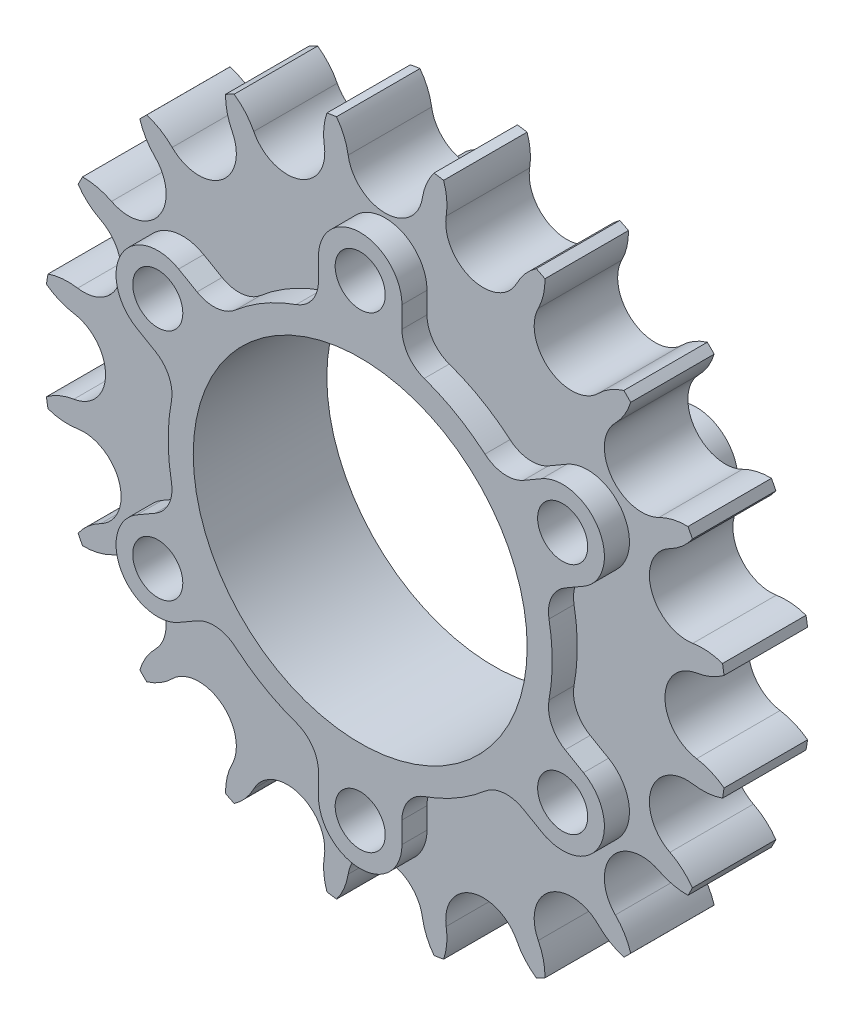
from build123d import *

# Parameters (mm, degrees)
SKETCH1_R           = 20.5
SKETCH1_R_2         = 10
BOSS_EXTRUDE1_DEPTH = 2.5
SKETCH2_R           = 10
BOSS_EXTRUDE2_DEPTH = 4
SKETCH3_R           = 1.5
CUT_EXTRUDE1_DEPTH  = 10
CUT_EXTRUDE2_DEPTH  = 30.266021253
CIRPATTERN1_COUNT   = 20


with BuildPart() as part:
    # Sketch1 → Boss-Extrude1 (new, symmetric)
    with BuildSketch(Plane.XY):
        Circle(SKETCH1_R)
        Circle(SKETCH1_R_2, mode=Mode.SUBTRACT)
    extrude(amount=BOSS_EXTRUDE1_DEPTH, both=True)

    # Sketch2 → Boss-Extrude2 (add, symmetric)
    with BuildSketch(Plane.XY):
        with BuildLine():
            Line((2.5, 14), (2.5, 12.727922061))
            ThreePointArc((2.5, 12.727922061), (2.867006838, 11.573221523), (3.833333333, 10.842303978))
            ThreePointArc((3.833333333, 10.842303978), (5.75, 9.959292144), (7.473044014, 8.740916037))
            ThreePointArc((7.473044014, 8.740916037), (8.589200423, 8.269511516), (9.772703843, 8.52902454))
            Line((9.772703843, 8.52902454), (10.874355653, 9.165063509))
            ThreePointArc((10.874355653, 9.165063509), (14.289419162, 8.25), (13.374355653, 4.834936491))
            Line((13.374355653, 4.834936491), (12.272703843, 4.198897521))
            ThreePointArc((12.272703843, 4.198897521), (11.456207262, 3.303710007), (11.306377347, 2.101387941))
            ThreePointArc((11.306377347, 2.101387941), (11.5, 0), (11.306377347, -2.101387941))
            ThreePointArc((11.306377347, -2.101387941), (11.456207262, -3.303710007), (12.272703843, -4.198897521))
            Line((12.272703843, -4.198897521), (13.374355653, -4.834936491))
            ThreePointArc((13.374355653, -4.834936491), (14.289419162, -8.25), (10.874355653, -9.165063509))
            Line((10.874355653, -9.165063509), (9.772703843, -8.52902454))
            ThreePointArc((9.772703843, -8.52902454), (8.589200423, -8.269511516), (7.473044014, -8.740916037))
            ThreePointArc((7.473044014, -8.740916037), (5.75, -9.959292144), (3.833333333, -10.842303978))
            ThreePointArc((3.833333333, -10.842303978), (2.867006838, -11.573221523), (2.5, -12.727922061))
            Line((2.5, -12.727922061), (2.5, -14))
            ThreePointArc((2.5, -14), (0, -16.5), (-2.5, -14))
            Line((-2.5, -14), (-2.5, -12.727922061))
            ThreePointArc((-2.5, -12.727922061), (-2.867006838, -11.573221523), (-3.833333333, -10.842303978))
            ThreePointArc((-3.833333333, -10.842303978), (-5.75, -9.959292144), (-7.473044014, -8.740916037))
            ThreePointArc((-7.473044014, -8.740916037), (-8.589200423, -8.269511516), (-9.772703843, -8.52902454))
            Line((-9.772703843, -8.52902454), (-10.874355653, -9.165063509))
            ThreePointArc((-10.874355653, -9.165063509), (-14.289419162, -8.25), (-13.374355653, -4.834936491))
            Line((-13.374355653, -4.834936491), (-12.272703843, -4.198897521))
            ThreePointArc((-12.272703843, -4.198897521), (-11.456207262, -3.303710007), (-11.306377347, -2.101387941))
            ThreePointArc((-11.306377347, -2.101387941), (-11.5, 0), (-11.306377347, 2.101387941))
            ThreePointArc((-11.306377347, 2.101387941), (-11.456207262, 3.303710007), (-12.272703843, 4.198897521))
            Line((-12.272703843, 4.198897521), (-13.374355653, 4.834936491))
            ThreePointArc((-13.374355653, 4.834936491), (-14.289419162, 8.25), (-10.874355653, 9.165063509))
            Line((-10.874355653, 9.165063509), (-9.772703843, 8.52902454))
            ThreePointArc((-9.772703843, 8.52902454), (-8.589200423, 8.269511516), (-7.473044014, 8.740916037))
            ThreePointArc((-7.473044014, 8.740916037), (-5.75, 9.959292144), (-3.833333333, 10.842303978))
            ThreePointArc((-3.833333333, 10.842303978), (-2.867006838, 11.573221523), (-2.5, 12.727922061))
            Line((-2.5, 12.727922061), (-2.5, 14))
            ThreePointArc((-2.5, 14), (0, 16.5), (2.5, 14))
        make_face()
        Circle(SKETCH2_R, mode=Mode.SUBTRACT)
    extrude(amount=BOSS_EXTRUDE2_DEPTH, both=True)

    # Sketch3 → Cut-Extrude1 (cut)
    with BuildSketch(Plane.XY.offset(4)):
        with Locations((0, 14)):
            Circle(SKETCH3_R)
        with Locations((12.124355653, 7)):
            Circle(SKETCH3_R)
        with Locations((12.124355653, -7)):
            Circle(SKETCH3_R)
        with Locations((0, -14)):
            Circle(SKETCH3_R)
        with Locations((-12.124355653, -7)):
            Circle(SKETCH3_R)
        with Locations((-12.124355653, 7)):
            Circle(SKETCH3_R)
    extrude(amount=-CUT_EXTRUDE1_DEPTH, mode=Mode.SUBTRACT)

    # Sketch4 → Cut-Extrude2 (cut, symmetric)
    with BuildSketch(Plane.XY):
        with BuildLine():
            ThreePointArc((2.22229877, 18.648022478), (2.585917373, 19.75989992), (3.278930955, 20.702355282))
            ThreePointArc((3.278930955, 20.702355282), (0, 22.694509672), (-3.278930955, 20.702355282))
            ThreePointArc((-3.278930955, 20.702355282), (-2.585917373, 19.759899919), (-2.22229877, 18.648022475))
            ThreePointArc((-2.22229877, 18.648022475), (1e-09, 16.75), (2.22229877, 18.648022478))
        make_face()
    cut_extrude2 = extrude(amount=CUT_EXTRUDE2_DEPTH, both=True, mode=Mode.SUBTRACT)

    # CirPattern1: Cut-Extrude2 ×20 about axis
    cirpattern1_axis = Axis((0, 0, 2.5), (0, 0, 1))
    for i in range(1, CIRPATTERN1_COUNT):
        add(cut_extrude2.rotate(cirpattern1_axis, i * 360 / CIRPATTERN1_COUNT), mode=Mode.SUBTRACT)


solid = part.part
